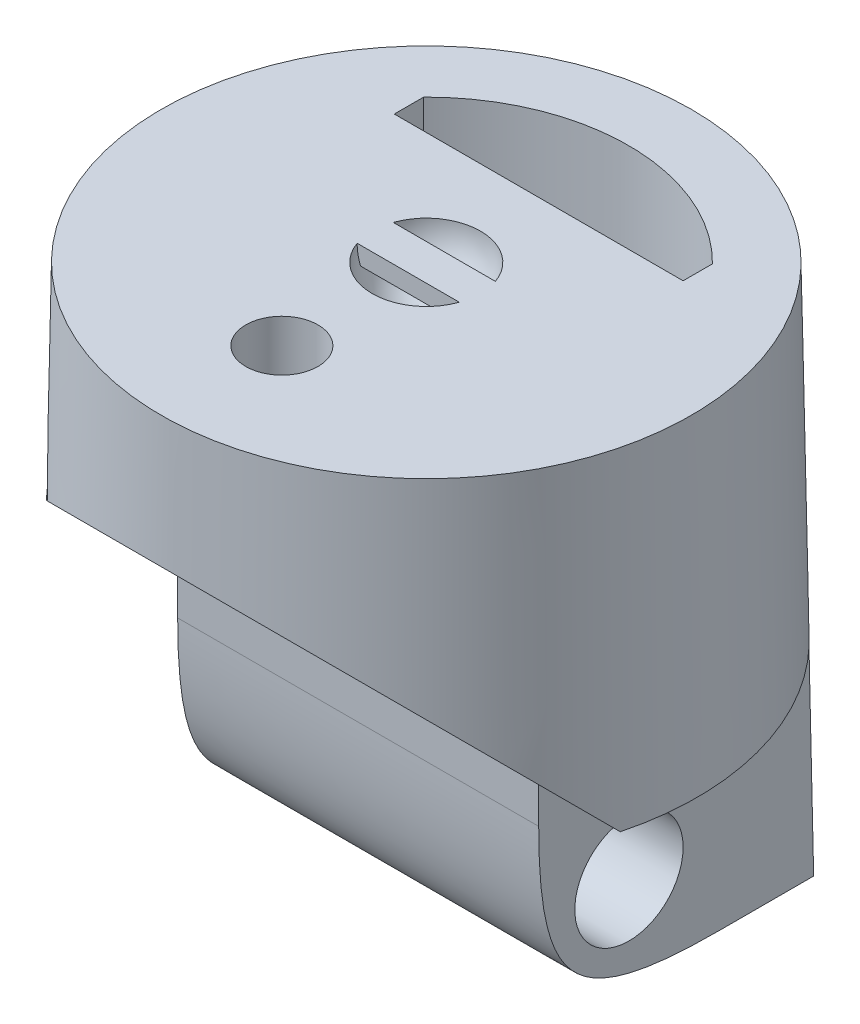
from build123d import *

# Parameters (mm, degrees)
SKETCH1_R                     = 7.5
BOSS_EXTRUDE1_DEPTH           = 19
BOSS_EXTRUDE1_TAPER           = 1
BOSS_EXTRUDE1_OTHER_WAY_DEPTH = 6
BOSS_EXTRUDE1_OTHER_WAY_TAPER = -1
CUT_EXTRUDE1_DEPTH            = 22.832632654
CUT_EXTRUDE1_DEPTH_BACK       = 22.832632654
CUT_EXTRUDE2_START            = -9.490788257
CUT_EXTRUDE2_OUTLINE_W        = 6.502745185
CUT_EXTRUDE2_OUTLINE_H        = 6
CUT_EXTRUDE2_DEPTH            = 9.490788257
SKETCH5_R                     = 1.5
CUT_EXTRUDE3_DEPTH            = 24.980865958
FILLET1_SIZE                  = 5
CUT_EXTRUDE4_DEPTH            = 22.796374265
CUT_EXTRUDE4_DEPTH_BACK       = 22.796374265
SKETCH6_W                     = 18.67842866
SKETCH6_H                     = 10.912736301
CUT_EXTRUDE5_DEPTH            = 19.48533084
SKETCH8_R                     = 1
CUT_EXTRUDE6_DEPTH            = 10
BOSS_EXTRUDE2_DEPTH           = 0.5


with BuildPart() as part:
    # Sketch1 → Boss-Extrude1 (new body)
    with BuildSketch(Plane(origin=(0, 0, 0), x_dir=(1, 0, 0), z_dir=(0, 1, 0))):
        Circle(SKETCH1_R)
    extrude(amount=BOSS_EXTRUDE1_DEPTH, taper=BOSS_EXTRUDE1_TAPER)

    # Sketch1 → Boss-Extrude1 other way (add)
    with BuildSketch(Plane(origin=(0, 0, 0), x_dir=(1, 0, 0), z_dir=(0, 1, 0))):
        Circle(SKETCH1_R)
    extrude(amount=-BOSS_EXTRUDE1_OTHER_WAY_DEPTH, taper=BOSS_EXTRUDE1_OTHER_WAY_TAPER)

    # Sketch3 → Cut-Extrude1 (cut, two sides: drawn at the far end of the back side and taken through both)
    with BuildSketch(Plane(origin=(0, 0, 0), x_dir=(0, 0, -1), z_dir=(1, 0, 0)).offset(-CUT_EXTRUDE1_DEPTH_BACK)):
        Polygon((-1.886057768, -6), (-1.886057768, 0), (-9.929766736, 8.043708969), (-9.929766736, -6), align=None)
    extrude(amount=CUT_EXTRUDE1_DEPTH + CUT_EXTRUDE1_DEPTH_BACK, mode=Mode.SUBTRACT)

    # Cut-Extrude2: read off the stored shape, not the designer's step
    # Cut-Extrude2 outline → Cut-Extrude2 (cut)
    with BuildSketch(Plane.XY.offset(1.886057768).offset(CUT_EXTRUDE2_START)):
        with Locations((-8.251372593, -3)):
            Rectangle(CUT_EXTRUDE2_OUTLINE_W, CUT_EXTRUDE2_OUTLINE_H)
        with Locations((8.251372593, -3)):
            Rectangle(CUT_EXTRUDE2_OUTLINE_W, CUT_EXTRUDE2_OUTLINE_H)
    extrude(amount=CUT_EXTRUDE2_DEPTH, mode=Mode.SUBTRACT)

    # Sketch5 → Cut-Extrude3 (cut, through all)
    with BuildSketch(Plane(origin=(5, 0, 0), x_dir=(0, 0, -1), z_dir=(1, 0, 0))):
        with Locations((0.613942232, -3.5)):
            Circle(SKETCH5_R)
    extrude(amount=-CUT_EXTRUDE3_DEPTH, mode=Mode.SUBTRACT)

    # Fillet1
    # a fillet whose section is not a circle: 5 mm, written as the material it takes off along each edge
    with BuildSketch(Plane(origin=(17.5, -6, 1.886057768), x_dir=(0, 0, -1), z_dir=(-1, 0, 0))) as fillet1_piece_1:
        with BuildLine():
            Bezier((FILLET1_SIZE, 0), (0, 0), (0, -FILLET1_SIZE), weights=[1, 1.5, 1])
            Line((0, -FILLET1_SIZE), (0, 0))
            Line((0, 0), (FILLET1_SIZE, 0))
        make_face()
    extrude(amount=35, mode=Mode.SUBTRACT)

    # Fillet2
    # a fillet whose section is not a circle: 10, 5 mm, written as the material it takes off along each edge
    with BuildSketch(Plane(origin=(0, 19, 0), x_dir=(1, 0, 0), z_dir=(0, 0, -1))) as fillet2_piece_1:
        with BuildLine():
            Bezier((7.341381251, 9.912737968), (7.168353766, 0), (2.342142775, 0), weights=[1, 0.818181818, 1])
            Line((2.342142775, 0), (7.168353766, 0))
            Line((7.168353766, 0), (7.341381251, 9.912737968))
        make_face()
    revolve(axis=Axis((0, 19, 0), (0, -1, 0)), mode=Mode.SUBTRACT)

    # Sketch6 → Cut-Extrude4 (cut, two sides: drawn at the far end of the back side and taken through both)
    with BuildSketch(Plane(origin=(0, 0, 0), x_dir=(0, 0, -1), z_dir=(1, 0, 0)).offset(-CUT_EXTRUDE4_DEPTH_BACK)):
        with Locations((-1.153671222, 14.54363185)):
            Rectangle(SKETCH6_W, SKETCH6_H)
    extrude(amount=CUT_EXTRUDE4_DEPTH + CUT_EXTRUDE4_DEPTH_BACK, mode=Mode.SUBTRACT)

    # Sketch7 → Cut-Extrude5 (cut, through all)
    with BuildSketch(Plane.XZ.offset(6)):
        with BuildLine():
            Line((4, -3.113942232), (4, -3.925939727))
            ThreePointArc((4, -3.925939727), (0, -5.60473039), (-4, -3.925939727))
            Line((-4, -3.925939727), (-4, -3.113942232))
            Line((-4, -3.113942232), (4, -3.113942232))
        make_face()
    extrude(amount=-CUT_EXTRUDE5_DEPTH, mode=Mode.SUBTRACT)

    # Sketch8 → Cut-Extrude6 (cut)
    with BuildSketch(Plane(origin=(0, 9.087263699, 0), x_dir=(1, 0, 0), z_dir=(0, 1, 0))):
        with Locations(Location((0, -4, 0), (0, 0, 270))):
            Circle(SKETCH8_R)
    extrude(amount=-CUT_EXTRUDE6_DEPTH, mode=Mode.SUBTRACT)

    # Sketch9 → Cut-Revolve1 (revolve, cut)
    with BuildSketch(Plane(origin=(0, 9.087263699, 0), x_dir=(1, 0, 0), z_dir=(0, 1, 0))):
        with BuildLine():
            Line((-1.5, 0), (1.5, 0))
            ThreePointArc((1.5, 0), (0, 1.5), (-1.5, 0))
        make_face()
    revolve(axis=Axis((-1.5, 9.087263699, 0), (1, 0, 0)), mode=Mode.SUBTRACT)

    # Sketch10 → Boss-Extrude2 (add)
    with BuildSketch(Plane(origin=(0, 9.087263699, 0), x_dir=(1, 0, 0), z_dir=(0, 1, 0))):
        with BuildLine():
            ThreePointArc((-1.414213562, 0.5), (-1.5, 0), (-1.414213562, -0.5))
            Line((-1.414213562, -0.5), (1.414213562, -0.5))
            ThreePointArc((1.414213562, -0.5), (1.478397839, -0.253652968), (1.5, 0))
            ThreePointArc((1.5, 0), (1.478397839, 0.253652968), (1.414213562, 0.5))
            Line((1.414213562, 0.5), (-1.414213562, 0.5))
        make_face()
    extrude(amount=-BOSS_EXTRUDE2_DEPTH)


solid = part.part
